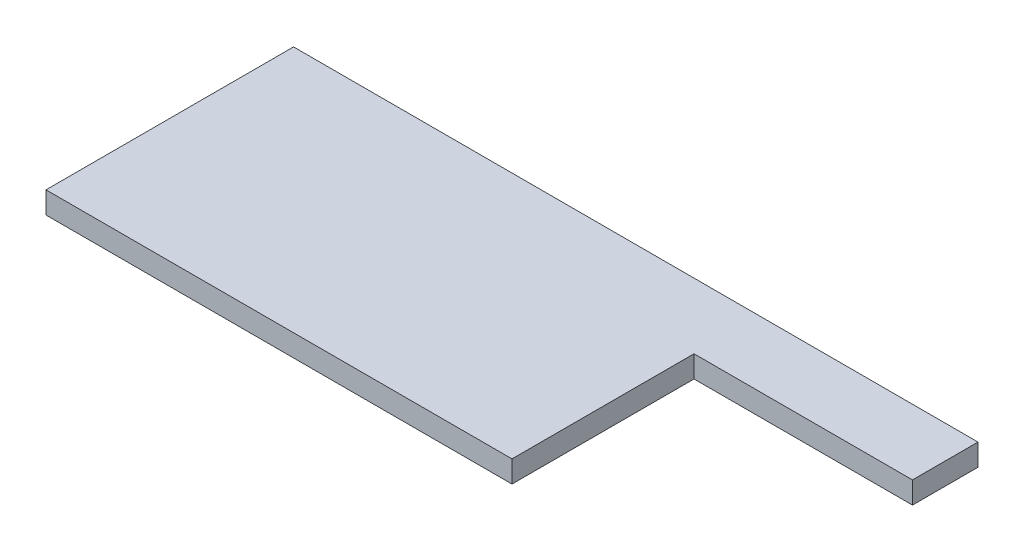
from build123d import *

# Parameters (mm, degrees)
SKETCH1_W           = 188
SKETCH1_H           = 68
BOSS_EXTRUDE1_DEPTH = 6
SKETCH2_W           = 60
SKETCH2_H           = 50
CUT_EXTRUDE1_DEPTH  = 201.00999975


with BuildPart() as part:
    # Sketch1 → Boss-Extrude1 (new body)
    with BuildSketch(Plane(origin=(0, 0, 0), x_dir=(1, 0, 0), z_dir=(0, 1, 0))):
        with Locations((94, 34)):
            Rectangle(SKETCH1_W, SKETCH1_H)
    extrude(amount=BOSS_EXTRUDE1_DEPTH)

    # Sketch2 → Cut-Extrude1 (cut, through all)
    with BuildSketch(Plane(origin=(0, 6, 0), x_dir=(1, 0, 0), z_dir=(0, 1, 0))):
        with Locations((158, 25)):
            Rectangle(SKETCH2_W, SKETCH2_H)
    extrude(amount=-CUT_EXTRUDE1_DEPTH, mode=Mode.SUBTRACT)


solid = part.part
